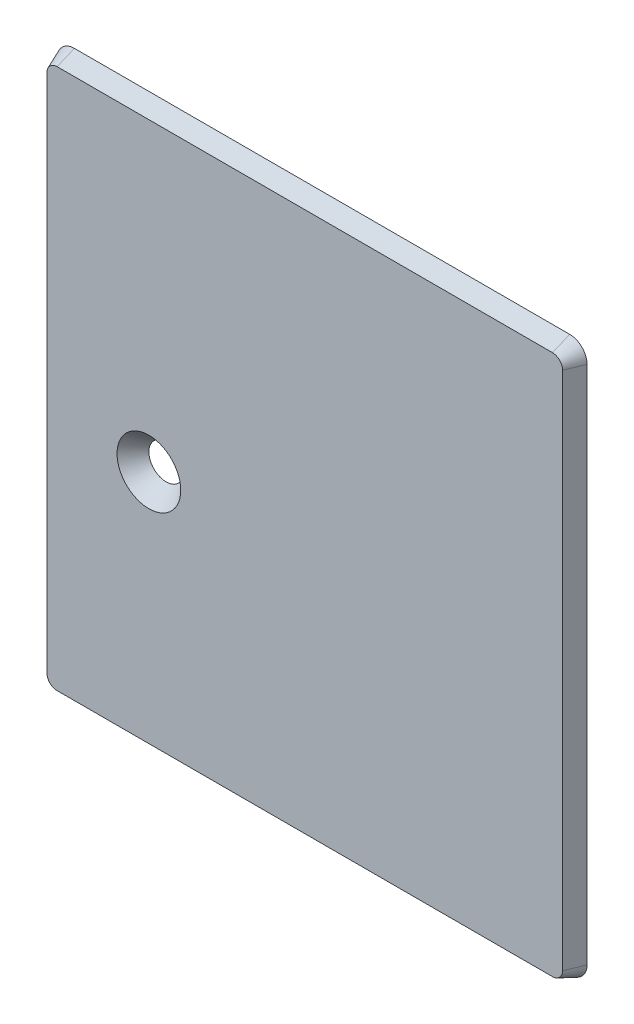
from build123d import *

# Parameters (mm, degrees)
TOP_START          = 1.5
TOP_DEPTH          = 2
BUTTON_DRAFT_ANGLE = -40
DRAFT2_ANGLE       = -22.5


with BuildPart() as part:
    # Sketch1 → top (new body)
    with BuildSketch(Plane.XY.offset(5.065997982).offset(TOP_START)):
        with BuildLine():
            Line((56.60000122, 60.0604), (-0.59999878, 60.0604))
            ThreePointArc((-0.59999878, 60.0604), (-2.014212342, 59.474613562), (-2.59999878, 58.0604))
            Line((-2.59999878, 58.0604), (-2.59999878, -2))
            ThreePointArc((-2.59999878, -2), (-2.014212342, -3.414213562), (-0.59999878, -4))
            Line((-0.59999878, -4), (56.60000122, -4))
            ThreePointArc((56.60000122, -4), (58.014214782, -3.414213562), (58.60000122, -2))
            Line((58.60000122, -2), (58.60000122, 58.0604))
            ThreePointArc((58.60000122, 58.0604), (58.014214782, 59.474613562), (56.60000122, 60.0604))
        make_face()
        with BuildLine():
            ThreePointArc((8.000100382, 23.999958151), (10.000100295, 25.999958238), (12.000100382, 23.999958326))
            ThreePointArc((12.000100382, 23.999958326), (10.00010047, 21.999958238), (8.000100382, 23.999958151))
        make_face(mode=Mode.SUBTRACT)
    extrude(amount=-TOP_DEPTH)

    # button draft
    button_draft_faces = [part.faces().sort_by_distance(p)[0] for p in [
        (12.000100382, 23.999958326, 5.565997982),
    ]]
    draft(button_draft_faces, Plane(origin=(0, 0, 4.565997982), x_dir=(-1, 0, 0), z_dir=(0, 0, -1)), BUTTON_DRAFT_ANGLE)

    # Draft2
    draft2_faces = [part.faces().sort_by_distance(p)[0] for p in [
        (58.014214782, -3.414213562, 5.565997982),
        (58.60000122, 28.0302, 5.565997982),
        (58.014214782, 59.474613562, 5.565997982),
        (28.00000122, 60.0604, 5.565997982),
        (-2.014212342, 59.474613562, 5.565997982),
        (-2.59999878, 28.0302, 5.565997982),
        (-2.014212342, -3.414213562, 5.565997982),
        (28.00000122, -4, 5.565997982),
    ]]
    draft(draft2_faces, Plane(origin=(0, 0, 4.565997982), x_dir=(-1, 0, 0), z_dir=(0, 0, -1)), DRAFT2_ANGLE)


solid = part.part
